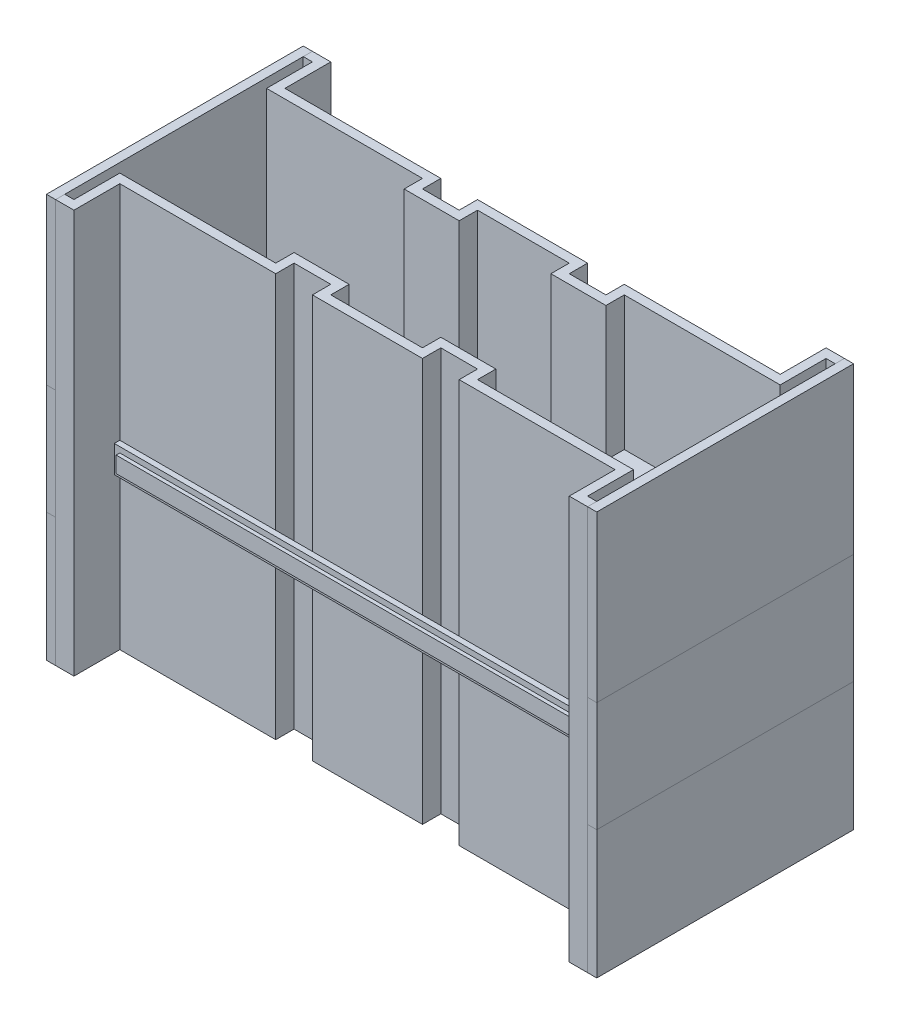
from build123d import *

# Parameters (mm, degrees)
EPAISSIR1_DEPTH         = 220
ESQUISSE4_W             = 140
ESQUISSE4_H             = 60
ESQUISSE4_H_2           = 80
ENL_V_MAT_EXTRU_1_DEPTH = 5
ESQUISSE5_W             = 140
ESQUISSE5_H             = 90
BOSS_EXTRU_3_DEPTH      = 5
ESQUISSE7_W             = 140
ESQUISSE7_H             = 60
BOSS_EXTRU_4_DEPTH      = 5
ESQUISSE8_W             = 140
ESQUISSE8_H             = 70
BOSS_EXTRU_5_DEPTH      = 5
ESQUISSE9_R             = 7.5
ESQUISSE9_W             = 38.519996312
ESQUISSE9_H             = 38.783125764
BOSS_EXTRU_6_DEPTH      = 3
ESQUISSE10_W            = 140
ESQUISSE10_H            = 220
ENL_V_MAT_EXTRU_2_DEPTH = 5
BOSS_EXTRU_7_DEPTH      = 5
ESQUISSE12_W            = 270
ESQUISSE12_H            = 14.751302264
BOSS_EXTRU_8_DEPTH      = 3
ESQUISSE13_W            = 264
ESQUISSE13_H            = 8.751302264
BOSS_EXTRU_9_DEPTH      = 2


# Read off the part's stored shape, not the designer's step: Epaissir1
with BuildPart() as part:
    # Epaissir1 outline → Epaissir1 (new body)
    with BuildSketch(Plane(origin=(0, 0, 0), x_dir=(1, 0, 0), z_dir=(0, 1, 0))):
        Polygon((50, 35), (30, 35), (30, 45), (-30, 45), (-30, 35), (-50, 35), (-50, 45), (-135, 45), (-135, 70), (-150, 70), (-150, -70), (-135, -70), (-135, -45), (-50, -45), (-50, -35), (-30, -35), (-30, -45), (30, -45), (30, -35), (50, -35), (50, -45), (135, -45), (135, -70), (150, -70), (150, 70), (135, 70), (135, 45), (50, 45), align=None)
        Polygon((25, 40), (25, 30), (55, 30), (55, 40), (140, 40), (140, 65), (145, 65), (145, -65), (140, -65), (140, -40), (55, -40), (55, -30), (25, -30), (25, -40), (-25, -40), (-25, -30), (-55, -30), (-55, -40), (-140, -40), (-140, -65), (-145, -65), (-145, 65), (-140, 65), (-140, 40), (-55, 40), (-55, 30), (-25, 30), (-25, 40), align=None, mode=Mode.SUBTRACT)
    extrude(amount=EPAISSIR1_DEPTH)

    # Esquisse4 → Enlèv. mat.-Extru.1 (cut)
    with BuildSketch(Plane(origin=(150, 0, 0), x_dir=(0, 0, -1), z_dir=(1, 0, 0))):
        with Locations((0, 110)):
            Rectangle(ESQUISSE4_W, ESQUISSE4_H)
        with Locations((0, 180)):
            Rectangle(ESQUISSE4_W, ESQUISSE4_H_2)
        with Locations((0, 40)):
            Rectangle(ESQUISSE4_W, ESQUISSE4_H_2)
    extrude(amount=-ENL_V_MAT_EXTRU_1_DEPTH, mode=Mode.SUBTRACT)

    # Esquisse10 → Enlèv. mat.-Extru.2 (cut)
    with BuildSketch(Plane.ZY.offset(150)):
        with Locations((0, 110)):
            Rectangle(ESQUISSE10_W, ESQUISSE10_H)
    extrude(amount=-ENL_V_MAT_EXTRU_2_DEPTH, mode=Mode.SUBTRACT)


with BuildPart() as body_2:
    # Esquisse5 → Boss.-Extru.3 (new body)
    with BuildSketch(Plane(origin=(145, 0, 0), x_dir=(0, 0, -1), z_dir=(1, 0, 0))):
        with Locations((0, 175)):
            Rectangle(ESQUISSE5_W, ESQUISSE5_H)
    extrude(amount=BOSS_EXTRU_3_DEPTH)


with BuildPart() as body_3:
    # Esquisse7 → Boss.-Extru.4 (new body)
    with BuildSketch(Plane(origin=(145, 0, 0), x_dir=(0, 0, -1), z_dir=(1, 0, 0))):
        with Locations((0, 100)):
            Rectangle(ESQUISSE7_W, ESQUISSE7_H)
    extrude(amount=BOSS_EXTRU_4_DEPTH)


with BuildPart() as body_4:
    # Esquisse8 → Boss.-Extru.5 (new body)
    with BuildSketch(Plane(origin=(145, 0, 0), x_dir=(0, 0, -1), z_dir=(1, 0, 0))):
        with Locations((0, 35)):
            Rectangle(ESQUISSE8_W, ESQUISSE8_H)
    extrude(amount=BOSS_EXTRU_5_DEPTH)


with BuildPart() as body_5:
    # Esquisse9 → Boss.-Extru.6 (new body)
    with BuildSketch(Plane(origin=(0, 80, 0), x_dir=(-1, 0, 0), z_dir=(0, -1, 0))):
        Polygon((-140, 40), (-140, -40), (-55, -40), (-55, -30), (-25, -30), (-25, -40), (25, -40), (25, -30), (55, -30), (55, -40), (140, -40), (140, 40), (55, 40), (55, 30), (25, 30), (25, 40), (-25, 40), (-25, 30), (-55, 30), (-55, 40), align=None)
        with Locations(Location((22.715511581, 0, 0), (0, 0, 90))):
            Circle(ESQUISSE9_R, mode=Mode.SUBTRACT)
        with Locations(Location((-47.284488419, 0, 0), (0, 0, 90))):
            Circle(ESQUISSE9_R, mode=Mode.SUBTRACT)
        with Locations(Location((-117.284488419, 0, 0), (0, 0, 90))):
            Circle(ESQUISSE9_R, mode=Mode.SUBTRACT)
        with Locations((82.070881684, 0)):
            Rectangle(ESQUISSE9_W, ESQUISSE9_H, mode=Mode.SUBTRACT)
    extrude(amount=BOSS_EXTRU_6_DEPTH)


with BuildPart() as enl_v_mat_extru_2_piece_1:
    # of the separate pieces the step leaves, piece 1, a body of its own (enl_v_mat_extru_2_pieces)
    add(part.part.solids().sort_by_distance((-140, 0, 65))[0])



with BuildPart() as enl_v_mat_extru_2_piece_2:
    # of the separate pieces the step leaves, piece 2, a body of its own (enl_v_mat_extru_2_pieces)
    add(part.part.solids().sort_by_distance((50, 0, -35))[0])


with BuildPart() as body_7:
    # Symétrie1: mirrored copy
    add(body_2.part.mirror(Plane(origin=(0, 0, 0), x_dir=(0, 0, 1), z_dir=(1, 0, 0))))


with BuildPart() as body_8:
    # Sym_trie1 2: mirrored copy
    add(body_3.part.mirror(Plane(origin=(0, 0, 0), x_dir=(0, 0, 1), z_dir=(1, 0, 0))))


with BuildPart() as body_9:
    # Sym_trie1 3: mirrored copy
    add(body_4.part.mirror(Plane(origin=(0, 0, 0), x_dir=(0, 0, 1), z_dir=(1, 0, 0))))


with BuildPart() as enl_v_mat_extru_2_piece_1_1:
    add(enl_v_mat_extru_2_piece_1.part)

    add(enl_v_mat_extru_2_piece_2.part)  # Boss.-Extru.7 merges Enlèv. mat.-Extru.2 piece 2
    # Esquisse11 → Boss.-Extru.7 (add)
    with BuildSketch(Plane(origin=(0, 147, 0), x_dir=(-1, 0, 0), z_dir=(0, -1, 0))):
        Polygon((-25, -30), (-25, 30), (-55, 30), (-55, 40), (-140, 40), (-140, -40), (-55, -40), (-55, -30), align=None)
    extrude(amount=BOSS_EXTRU_7_DEPTH)


with BuildPart() as body_9_2:
    # Esquisse12 → Boss.-Extru.8 (new body)
    with BuildSketch(Plane.XY.offset(45)):
        with Locations((0, 91.493820797)):
            Rectangle(ESQUISSE12_W, ESQUISSE12_H)
    extrude(amount=BOSS_EXTRU_8_DEPTH)


with BuildPart() as body_10:
    # Esquisse13 → Boss.-Extru.9 (new body)
    with BuildSketch(Plane.XY.offset(48)):
        with Locations((0, 91.493820797)):
            Rectangle(ESQUISSE13_W, ESQUISSE13_H)
    extrude(amount=BOSS_EXTRU_9_DEPTH)


with BuildPart() as body_11:
    # Symétrie2: mirrored copy
    add(body_10.part.mirror(Plane.XY))


with BuildPart() as body_12:
    # Sym_trie2 2: mirrored copy
    add(body_9_2.part.mirror(Plane.XY))


solid = Compound([body_2.part, body_3.part, body_4.part, body_5.part, body_7.part, body_8.part, body_9.part, enl_v_mat_extru_2_piece_1_1.part, body_9_2.part, body_10.part, body_11.part, body_12.part])
